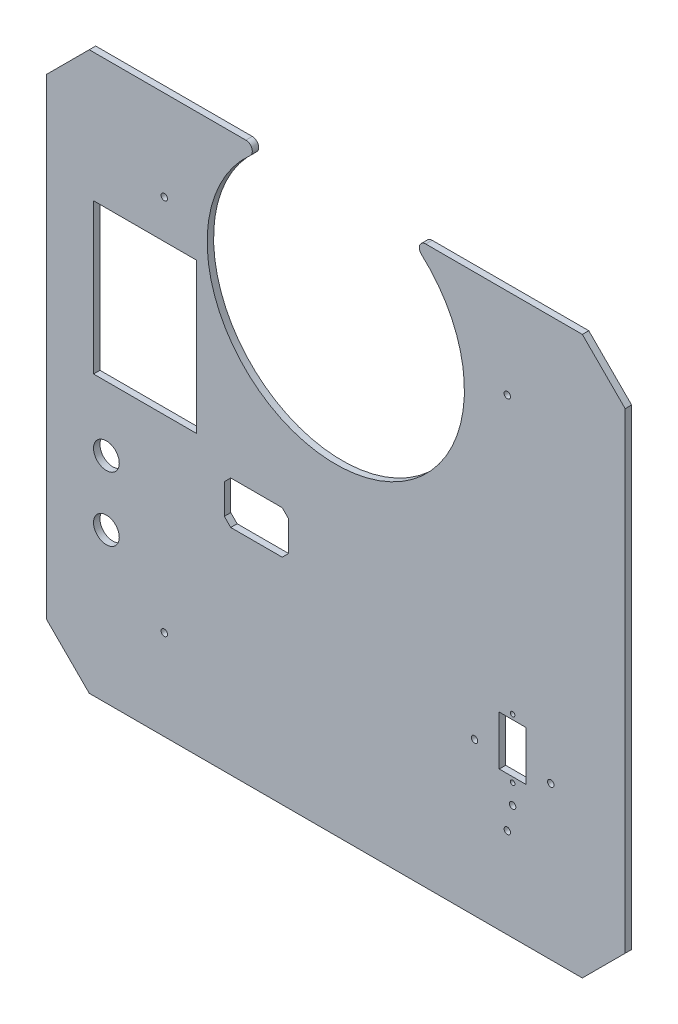
from build123d import *

# Parameters (mm, degrees)
SKETCH_1_W          = 270
SKETCH_1_H          = 260
EXTRUDE_1_DEPTH     = 3
CHAMFER_2_SIZE      = 20
SKETCH_4_R          = 60
CUT_EXTRUDE_1_DEPTH = 10
FILLET_1_R          = 3
SKETCH_5_R          = 1.5
SKETCH_5_R_2        = 1.05
SKETCH_5_W          = 12.5
SKETCH_5_H          = 23.002638066
CUT_EXTRUDE_2_DEPTH = 10
SKETCH_6_W          = 48
SKETCH_6_H          = 70
CUT_EXTRUDE_3_DEPTH = 0.1
SKETCH_10_W         = 48
SKETCH_10_H         = 70
CUT_EXTRUDE_4_DEPTH = 188.440657276
SKETCH_11_R         = 6
CUT_EXTRUDE_5_DEPTH = 188.440657276
SKETCH_13_R         = 1.5
CUT_EXTRUDE_6_DEPTH = 188.440657276
SKETCH_15_W         = 30
SKETCH_15_H         = 20
CUT_EXTRUDE_8_DEPTH = 188.440657276
CHAMFER_4_SIZE      = 3


with BuildPart() as part:
    # 草图1 → 凸台-拉伸1 (new body)
    with BuildSketch(Plane.XY):
        Rectangle(SKETCH_1_W, SKETCH_1_H)
    extrude(amount=EXTRUDE_1_DEPTH)

    # 倒角2
    chamfer_2_edges = [part.edges().sort_by_distance(p)[0] for p in [
        (-135, -130, 1.5),
        (135, -130, 1.5),
        (135, 130, 1.5),
        (-135, 130, 1.5),
    ]]
    chamfer(chamfer_2_edges, length=CHAMFER_2_SIZE)

    # 草图4 → 切除-拉伸1 (cut)
    with BuildSketch(Plane.XY.offset(3)):
        with Locations((0, 80)):
            Circle(SKETCH_4_R)
    extrude(amount=-CUT_EXTRUDE_1_DEPTH, mode=Mode.SUBTRACT)

    # 圆角1
    fillet_1_edges = [part.edges().sort_by_distance(p)[0] for p in [
        (-33.166247904, 130, 1.5),
        (33.166247904, 130, 1.5),
    ]]
    fillet(fillet_1_edges, radius=FILLET_1_R)

    # 草图5 → 切除-拉伸2 (cut)
    with BuildSketch(Plane(origin=(0, 0, 0), x_dir=(-1, 0, 0), z_dir=(0, 0, -1))):
        with Locations((-64.7, -58.75)):
            Circle(SKETCH_5_R)
        with Locations((-100.3, -58.75)):
            Circle(SKETCH_5_R)
        with Locations((-82.5, -76.55)):
            Circle(SKETCH_5_R)
        with Locations((-82.5, -39.65)):
            Circle(SKETCH_5_R_2)
        with Locations((-82.5, -67.35)):
            Circle(SKETCH_5_R_2)
        with Locations((-82.5, -53.445792921)):
            Rectangle(SKETCH_5_W, SKETCH_5_H)
    extrude(amount=-CUT_EXTRUDE_2_DEPTH, mode=Mode.SUBTRACT)

    # 草图6 → 切除-拉伸3 (cut)
    with BuildSketch(Plane(origin=(0, 0, 0), x_dir=(-1, 0, 0), z_dir=(0, 0, -1))):
        with Locations((89, 35)):
            Rectangle(SKETCH_6_W, SKETCH_6_H)
    extrude(amount=-CUT_EXTRUDE_3_DEPTH, mode=Mode.SUBTRACT)

    # 草图10 → 切除-拉伸4 (cut, through all)
    with BuildSketch(Plane(origin=(0, 0, 0), x_dir=(-1, 0, 0), z_dir=(0, 0, -1))):
        with Locations((89, 35)):
            Rectangle(SKETCH_10_W, SKETCH_10_H)
    extrude(amount=-CUT_EXTRUDE_4_DEPTH, mode=Mode.SUBTRACT)

    # 草图11 → 切除-拉伸5 (cut, through all)
    with BuildSketch(Plane.XY.offset(3)):
        with Locations((-107, -30)):
            Circle(SKETCH_11_R)
        with Locations((-107, -60)):
            Circle(SKETCH_11_R)
    extrude(amount=-CUT_EXTRUDE_5_DEPTH, mode=Mode.SUBTRACT)

    # 草图13 → 切除-拉伸6 (cut, through all)
    with BuildSketch(Plane(origin=(0, 0, 0), x_dir=(-1, 0, 0), z_dir=(0, 0, -1))):
        with Locations((80, 88)):
            Circle(SKETCH_13_R)
        with Locations((80, -88)):
            Circle(SKETCH_13_R)
        with Locations((-80, -88)):
            Circle(SKETCH_13_R)
        with Locations((-80, 88)):
            Circle(SKETCH_13_R)
    extrude(amount=-CUT_EXTRUDE_6_DEPTH, mode=Mode.SUBTRACT)

    # 草图15 → 切除-拉伸8 (cut, through all)
    with BuildSketch(Plane(origin=(0, 0, 0), x_dir=(-1, 0, 0), z_dir=(0, 0, -1))):
        with Locations((37, -20)):
            Rectangle(SKETCH_15_W, SKETCH_15_H)
    extrude(amount=-CUT_EXTRUDE_8_DEPTH, mode=Mode.SUBTRACT)

    # 倒角4
    chamfer_4_edges = [part.edges().sort_by_distance(p)[0] for p in [
        (-22, -10, 1.5),
        (-52, -10, 1.5),
        (-52, -30, 1.5),
        (-22, -30, 1.5),
    ]]
    chamfer(chamfer_4_edges, length=CHAMFER_4_SIZE)


solid = part.part
